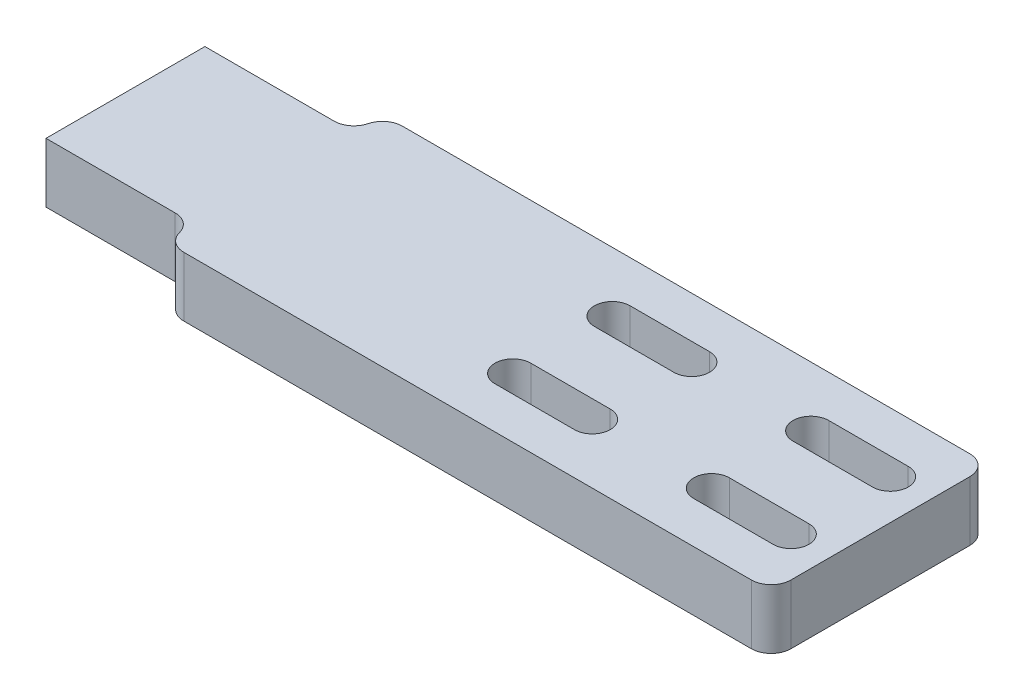
from build123d import *

# Parameters (mm, degrees)
BOSS_EXTRUDE1_DEPTH      = 6
M3_CLEARANCE_SLOT1_DEPTH = 6
M3_TAPPED_HOLE1_D        = 2.5
M3_TAPPED_HOLE1_DEPTH    = 8.5
M3_TAPPED_HOLE1_TIP      = 0.751075774
FILLET1_R                = 2


# Read off the part's stored shape, not the designer's step: M3 Clearance Slot1
with BuildPart() as part:
    # Sketch1 → Boss-Extrude1 (new body)
    with BuildSketch(Plane(origin=(0, 0, 0), x_dir=(1, 0, 0), z_dir=(0, 1, 0))):
        with BuildLine():
            Line((36, 11), (-23, 11))
            Line((-23, 11), (-23, 10))
            ThreePointArc((-23, 10), (-23.585786438, 8.585786438), (-25, 8))
            Line((-25, 8), (-38, 8))
            Line((-38, 8), (-38, -8))
            Line((-38, -8), (-25, -8))
            ThreePointArc((-25, -8), (-23.585786438, -8.585786438), (-23, -10))
            Line((-23, -10), (-23, -11))
            Line((-23, -11), (36, -11))
            ThreePointArc((36, -11), (37.414213562, -10.414213562), (38, -9))
            Line((38, -9), (38, 9))
            ThreePointArc((38, 9), (37.414213562, 10.414213562), (36, 11))
        make_face()
    extrude(amount=BOSS_EXTRUDE1_DEPTH)

    # M3 Clearance Slot1 outline → M3 Clearance Slot1 (cut)
    with BuildSketch(Plane(origin=(0, 0, 0), x_dir=(1, 0, 0), z_dir=(0, 1, 0))):
        with BuildLine():
            ThreePointArc((6, 6.8), (4.2, 5), (6, 3.2))
            Line((6, 3.2), (14, 3.2))
            ThreePointArc((14, 3.2), (15.8, 5), (14, 6.8))
            Line((14, 6.8), (6, 6.8))
        make_face()
        with BuildLine():
            ThreePointArc((34, 3.2), (35.8, 5), (34, 6.8))
            Line((34, 6.8), (26, 6.8))
            ThreePointArc((26, 6.8), (24.2, 5), (26, 3.2))
            Line((26, 3.2), (34, 3.2))
        make_face()
        with BuildLine():
            ThreePointArc((6, -3.2), (4.2, -5), (6, -6.8))
            Line((6, -6.8), (14, -6.8))
            ThreePointArc((14, -6.8), (15.8, -5), (14, -3.2))
            Line((14, -3.2), (6, -3.2))
        make_face()
        with BuildLine():
            ThreePointArc((34, -6.8), (35.8, -5), (34, -3.2))
            Line((34, -3.2), (26, -3.2))
            ThreePointArc((26, -3.2), (24.2, -5), (26, -6.8))
            Line((26, -6.8), (34, -6.8))
        make_face()
    extrude(amount=M3_CLEARANCE_SLOT1_DEPTH, mode=Mode.SUBTRACT)

    # M3 Tapped Hole1
    with Locations(Plane.ZY.offset(38)):
        with Locations((-5, 2.934782609), (5, 2.934782609)):
            Hole(M3_TAPPED_HOLE1_D / 2, depth=M3_TAPPED_HOLE1_DEPTH)
            with Locations((0, 0, -(M3_TAPPED_HOLE1_DEPTH + M3_TAPPED_HOLE1_TIP / 2))):  # 118° drill point
                Cone(0, M3_TAPPED_HOLE1_D / 2, M3_TAPPED_HOLE1_TIP, mode=Mode.SUBTRACT)

    # Fillet1
    fillet1_edges = [part.edges().sort_by_distance(p)[0] for p in [
        (-23, 3, 11),
        (-23, 3, -11),
    ]]
    fillet(fillet1_edges, radius=FILLET1_R)


solid = part.part
